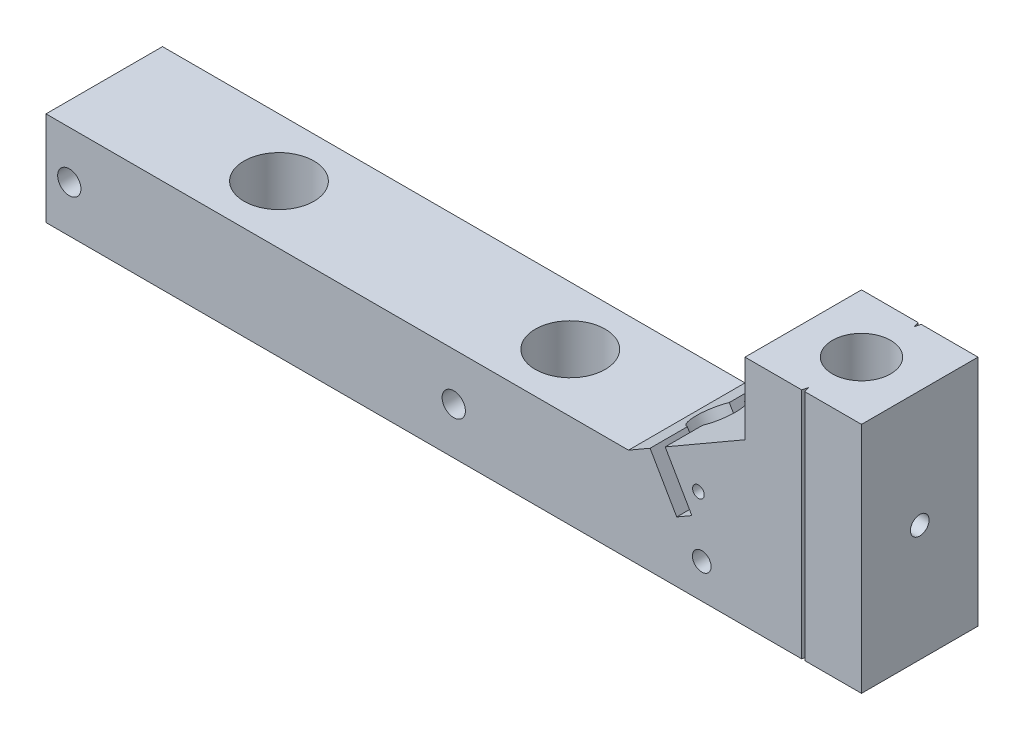
from build123d import *

# Parameters (mm, degrees)
SKETCH1_W                 = 20
SKETCH1_H                 = 10
BOSS_EXTRUDE1_DEPTH       = 20
SKETCH2_R                 = 2.5
CUT_EXTRUDE1_DEPTH        = 26.836409614
CUT_EXTRUDE2_DEPTH        = 27.191969955
SKETCH5_R                 = 1.95
CUT_EXTRUDE5_DEPTH        = 21.021203074
M2X0_4_TAPPED_HOLE1_D     = 1.6
M2X0_4_TAPPED_HOLE1_DEPTH = 6
M2X0_4_TAPPED_HOLE1_TIP   = 0.480688495
M2X0_4_TAPPED_HOLE2_D     = 1.6
M2X0_4_TAPPED_HOLE2_DEPTH = 6
M2X0_4_TAPPED_HOLE2_TIP   = 0.480688495
SKETCH14_W                = 10
SKETCH14_H                = 8.082903769
BOSS_EXTRUDE3_DEPTH       = 50
CUT_EXTRUDE7_REACH        = 67.371
SKETCH15_R                = 3
SKETCH16_R                = 1
CUT_EXTRUDE8_DEPTH        = 68.45300722
SKETCH18_R                = 0.5
CUT_EXTRUDE9_DEPTH        = 3


with BuildPart() as part:
    # Sketch1 → Boss-Extrude1 (new body)
    with BuildSketch(Plane(origin=(0, 0, 0), x_dir=(1, 0, 0), z_dir=(0, 1, 0))):
        with Locations((-3.638888889, 4.027777778)):
            Rectangle(SKETCH1_W, SKETCH1_H)
    extrude(amount=BOSS_EXTRUDE1_DEPTH)

    # Sketch2 → Cut-Extrude1 (cut, through all)
    with BuildSketch(Plane(origin=(0, 20, 0), x_dir=(1, 0, 0), z_dir=(0, 1, 0))):
        with Locations((1.361111111, 4.027777778)):
            Circle(SKETCH2_R)
        Polygon((1.495085707, -0.972222222), (1.361111111, -0.472222222), (1.227136515, -0.972222222), align=None)
        Polygon((1.361111111, 8.527777778), (1.227136515, 9.027777778), (1.495085707, 9.027777778), align=None)
    extrude(amount=-CUT_EXTRUDE1_DEPTH, mode=Mode.SUBTRACT)

    # Sketch3 → Cut-Extrude2 (cut, through all)
    with BuildSketch(Plane.XY.offset(0.972222222)):
        Polygon((-13.638888889, 20), (-3.638888889, 20), (-3.638888889, 13.856406461), (-10.489369836, 9.901279442), (-8.200869836, 5.937481169), (-9.499907942, 5.187481169), (-11.788407942, 9.151279442), (-13.638888889, 8.082903769), align=None)
    extrude(amount=-CUT_EXTRUDE2_DEPTH, mode=Mode.SUBTRACT)

    # Sketch5 → Cut-Extrude5 (cut, through all)
    with BuildSketch(Plane(origin=(-6.909722222, 11.967989955, 0), x_dir=(0.8660254037844415, 0.49999999999999534, 0), z_dir=(-0.49999999999999534, 0.8660254037844415, 0))):
        with Locations((-4.883421027, 4.027777778)):
            Circle(SKETCH5_R)
    extrude(amount=-CUT_EXTRUDE5_DEPTH, mode=Mode.SUBTRACT)

    # M2x0.4 Tapped Hole1
    with Locations(Plane(origin=(6.361111111, 0, 0), x_dir=(0, 0, -1), z_dir=(1, 0, 0))):
        with Locations((4.027777778, 10)):
            Hole(M2X0_4_TAPPED_HOLE1_D / 2, depth=M2X0_4_TAPPED_HOLE1_DEPTH)
            with Locations((0, 0, -(M2X0_4_TAPPED_HOLE1_DEPTH + M2X0_4_TAPPED_HOLE1_TIP / 2))):  # 118° drill point
                Cone(0, M2X0_4_TAPPED_HOLE1_D / 2, M2X0_4_TAPPED_HOLE1_TIP, mode=Mode.SUBTRACT)

    # M2x0.4 Tapped Hole2
    with Locations(Plane.XY.offset(0.972222222)):
        with Locations((-7.350388889, 2.964404957)):
            Hole(M2X0_4_TAPPED_HOLE2_D / 2, depth=M2X0_4_TAPPED_HOLE2_DEPTH)
            with Locations((0, 0, -(M2X0_4_TAPPED_HOLE2_DEPTH + M2X0_4_TAPPED_HOLE2_TIP / 2))):  # 118° drill point
                Cone(0, M2X0_4_TAPPED_HOLE2_D / 2, M2X0_4_TAPPED_HOLE2_TIP, mode=Mode.SUBTRACT)

    # Sketch14 → Boss-Extrude3 (add)
    with BuildSketch(Plane.ZY.offset(13.638888889)):
        with Locations((-4.027777778, 4.041451884)):
            Rectangle(SKETCH14_W, SKETCH14_H)
    extrude(amount=BOSS_EXTRUDE3_DEPTH)

    # Sketch15 → Cut-Extrude7 (cut, up to next)
    with BuildSketch(Plane(origin=(0, 8.082903769, 0), x_dir=(1, 0, 0), z_dir=(0, 1, 0)), mode=Mode.PRIVATE) as cut_extrude7_sk1:
        with Locations((-48.638888889, 4.027777778)):
            Circle(SKETCH15_R)
    cut_extrude7_tool1 = extrude(cut_extrude7_sk1.sketch, amount=-CUT_EXTRUDE7_REACH, mode=Mode.PRIVATE) & part.part
    # Sketch15 → Cut-Extrude7 (cut, up to next)
    with BuildSketch(Plane(origin=(0, 8.082903769, 0), x_dir=(1, 0, 0), z_dir=(0, 1, 0)), mode=Mode.PRIVATE) as cut_extrude7_sk2:
        with Locations((-23.638888889, 4.027777778)):
            Circle(SKETCH15_R)
    cut_extrude7_tool2 = extrude(cut_extrude7_sk2.sketch, amount=-CUT_EXTRUDE7_REACH, mode=Mode.PRIVATE) & part.part
    add(cut_extrude7_tool1.solids().sort_by_distance((-48.638889, 8.082904, -4.027778))[0], mode=Mode.SUBTRACT)
    add(cut_extrude7_tool2.solids().sort_by_distance((-23.638889, 8.082904, -4.027778))[0], mode=Mode.SUBTRACT)

    # Sketch16 → Cut-Extrude8 (cut, through all)
    with BuildSketch(Plane.XY.offset(0.972222222)):
        with Locations((-61.638888889, 4)):
            Circle(SKETCH16_R)
        with Locations((-28.638888889, 4)):
            Circle(SKETCH16_R)
    extrude(amount=-CUT_EXTRUDE8_DEPTH, mode=Mode.SUBTRACT)

    # Sketch18 → Cut-Extrude9 (cut)
    with BuildSketch(Plane.XY.offset(0.972222222)):
        with Locations((-7.638888889, 8)):
            Circle(SKETCH18_R)
    extrude(amount=-CUT_EXTRUDE9_DEPTH, mode=Mode.SUBTRACT)


solid = part.part
